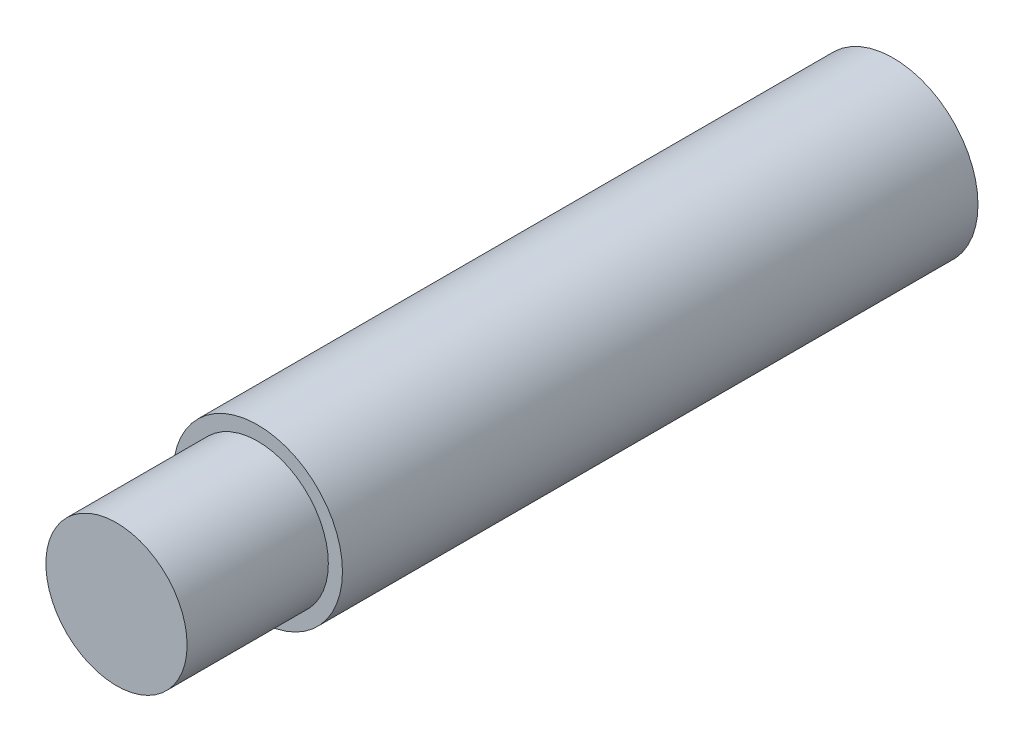
from build123d import *


with BuildPart() as part:
    # Sketch6 → Revolve1 (revolve)
    with BuildSketch(Plane(origin=(0, 0, 0), x_dir=(0, 0, -1), z_dir=(1, 0, 0))):
        Polygon((0, 0), (43, 0), (43, 3.5), (55, 3.5), (55, 6), (10, 6), (10, 5), (0, 5), align=None)
    revolve(axis=Axis((0, 0, 0), (0, 0, -1)))


solid = part.part
